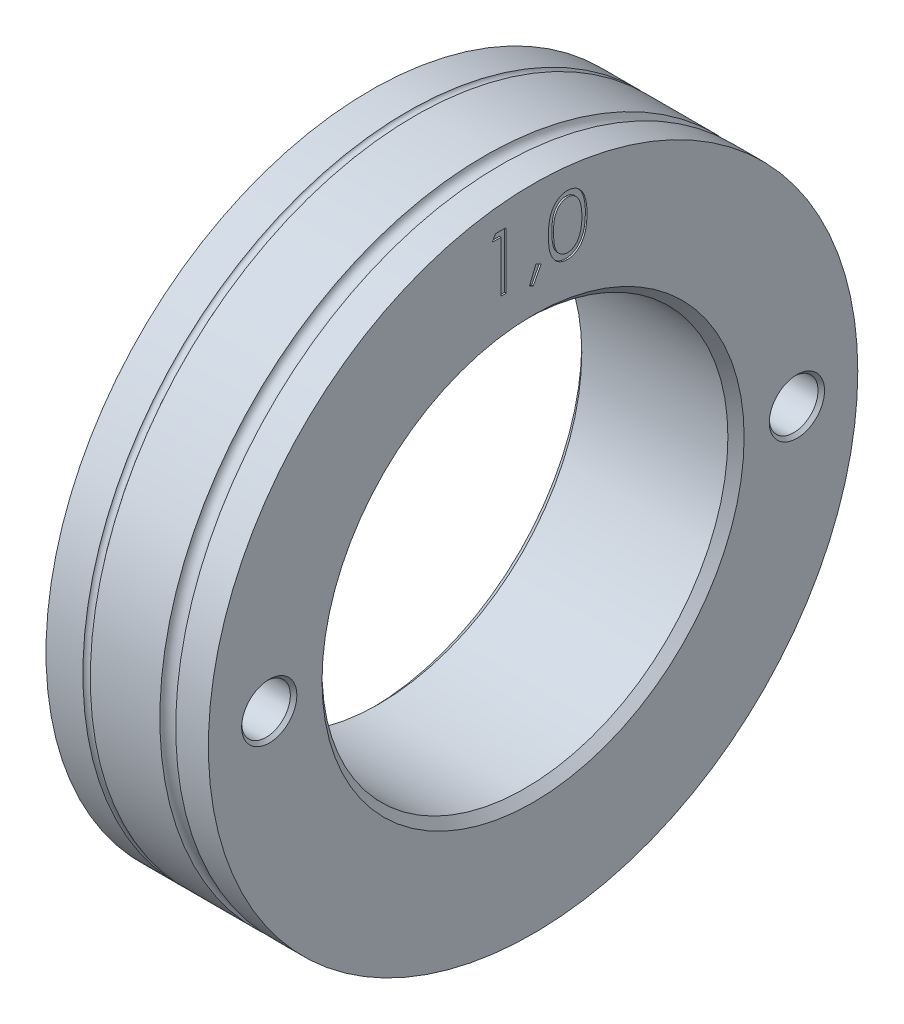
from build123d import *

# Parameters (mm, degrees)
CUT_EXTRUDE_1_DEPTH = 0.1
CUT_EXTRUDE_2_DEPTH = 0.1
SKETCH_5_R          = 1.5
CUT_EXTRUDE_3_DEPTH = 31.000000167
CHAMFER_1_SIZE      = 0.5
CHAMFER_2_SIZE      = 0.2


with BuildPart() as part:
    # Эскиз1 → Повернуть1 (revolve)
    with BuildSketch(Plane.XY):
        with BuildLine():
            Line((0, 12.5), (-10, 12.5))
            Line((-10, 12.5), (-10, 20))
            Line((-10, 20), (-7.727283258, 20))
            ThreePointArc((-7.727283258, 20), (-7.5, 19.854126465), (-7.272716742, 20))
            Line((-7.272716742, 20), (-2.989037503, 20))
            ThreePointArc((-2.989037503, 20), (-2.5, 19.604126465), (-2.010962497, 20))
            Line((-2.010962497, 20), (0, 20))
            Line((0, 20), (0, 12.5))
        make_face()
    revolve(axis=Axis((0, 0, 0), (-1, 0, 0)))

    # Эскиз2 → Вырез-Вытянуть1 (cut)
    # profile 1 of 3: a face of its own
    with BuildSketch(Plane.ZY.offset(10)):
        with BuildLine():
            add(Edge.make_bspline(
                [(-3.365384615, 16.748597756), (-3.365056597, 16.804695144), (-3.364419417, 16.913665128), (-3.357330996, 17.07244977), (-3.345555654, 17.221410059), (-3.329418281, 17.360553125), (-3.309780301, 17.48991489), (-3.283564814, 17.609149647), (-3.253752012, 17.718809254), (-3.219199566, 17.819251302), (-3.180211777, 17.911829005), (-3.137777516, 17.998254207), (-3.090212722, 18.078396139), (-3.040235809, 18.153533929), (-2.985823737, 18.222437624), (-2.928524947, 18.286080287), (-2.86610307, 18.342991037), (-2.800680062, 18.394837339), (-2.731663598, 18.440286811), (-2.661020932, 18.48031955), (-2.588265826, 18.514519417), (-2.513199643, 18.541409853), (-2.436497085, 18.5636207), (-2.357890018, 18.578809647), (-2.277248654, 18.588366556), (-2.22281722, 18.589280224), (-2.19521234, 18.58974359)],
                knots=[0, 0, 0, 0, 1.646270934, 3.197905019, 4.663502075, 6.030701355, 7.308322542, 8.50163776, 9.611534131, 10.641858119, 11.616356847, 12.558055219, 13.465016945, 14.349605745, 15.204443733, 16.039544428, 16.859896111, 17.680448484, 18.487036065, 19.28249412, 20.06191084, 20.843045899, 21.620316918, 22.403196591, 23.190181807, 24, 24, 24, 24], degree=3))
            add(Edge.make_bspline(
                [(-2.19521234, 18.58974359), (-2.167376861, 18.589255775), (-2.112020852, 18.588285664), (-2.030180477, 18.578961721), (-1.950230795, 18.563490598), (-1.872512657, 18.541569623), (-1.79638767, 18.514373947), (-1.722451263, 18.48028683), (-1.650244181, 18.440607962), (-1.580913893, 18.393984085), (-1.513699278, 18.342001809), (-1.450251315, 18.28323914), (-1.390564229, 18.218289421), (-1.333888924, 18.147847557), (-1.281833327, 18.070562472), (-1.232259894, 17.987778362), (-1.187887858, 17.898047497), (-1.145153183, 17.80286703), (-1.108266197, 17.699603371), (-1.074999951, 17.58883861), (-1.048120983, 17.469264423), (-1.02573171, 17.341508178), (-1.008386814, 17.205100695), (-0.995754172, 17.060334379), (-0.989081087, 16.907113989), (-0.987824386, 16.80235614), (-0.987179487, 16.748597756)],
                knots=[0, 0, 0, 0, 0.810914788, 1.612654377, 2.396697861, 3.181598691, 3.963628158, 4.749916497, 5.551656086, 6.361998678, 7.18212741, 8.025565596, 8.878627764, 9.750805457, 10.657531673, 11.591944965, 12.560506719, 13.57287815, 14.630710178, 15.753379473, 16.941251878, 18.199788006, 19.531962791, 20.947069417, 22.433333509, 24, 24, 24, 24], degree=3))
            add(Edge.make_bspline(
                [(-0.987179487, 16.748597756), (-0.987831072, 16.695073848), (-0.989100658, 16.590784697), (-0.995679364, 16.438253721), (-1.008637996, 16.294255678), (-1.024847984, 16.158445216), (-1.047298947, 16.031387597), (-1.074904113, 15.912643148), (-1.105554436, 15.801699077), (-1.14338923, 15.699464265), (-1.18479994, 15.604512542), (-1.229855137, 15.515845394), (-1.278124963, 15.432679101), (-1.330713708, 15.355679354), (-1.386767121, 15.284300697), (-1.44748491, 15.219803074), (-1.511155495, 15.160632402), (-1.578567911, 15.107980775), (-1.648979462, 15.06189597), (-1.720938539, 15.02068212), (-1.795721922, 14.987449425), (-1.871634875, 14.958914384), (-1.949763241, 14.937113932), (-2.030009632, 14.922040077), (-2.111965868, 14.911468228), (-2.167367433, 14.910661748), (-2.19521234, 14.91025641)],
                knots=[0, 0, 0, 0, 1.561518951, 3.042555995, 4.452378317, 5.7783523, 7.031515105, 8.214008947, 9.334062868, 10.386615937, 11.391082383, 12.354592575, 13.286541444, 14.194233754, 15.072674879, 15.931287219, 16.775624067, 17.606195743, 18.42308326, 19.229000347, 20.022332153, 20.807536673, 21.593273796, 22.3848459, 23.188221202, 24, 24, 24, 24], degree=3))
            add(Edge.make_bspline(
                [(-2.19521234, 14.91025641), (-2.222816454, 14.910722766), (-2.277246378, 14.911642328), (-2.357898804, 14.921156059), (-2.436181247, 14.936451562), (-2.512480001, 14.957868166), (-2.587186516, 14.984083003), (-2.659282803, 15.018236686), (-2.729570487, 15.057570755), (-2.797862043, 15.102366177), (-2.862874204, 15.15368786), (-2.924972809, 15.210452149), (-2.982597828, 15.27407556), (-3.036231924, 15.343553483), (-3.087206012, 15.418246725), (-3.134095385, 15.499175098), (-3.17746624, 15.586017709), (-3.21710973, 15.67933562), (-3.252258394, 15.780490547), (-3.283306102, 15.890639726), (-3.307820259, 16.010755362), (-3.328803215, 16.139872729), (-3.345727598, 16.278546659), (-3.357281923, 16.426852438), (-3.364423238, 16.584697647), (-3.365058308, 16.692967421), (-3.365384615, 16.748597756)],
                knots=[0, 0, 0, 0, 0.810891512, 1.598919785, 2.382837074, 3.152667961, 3.926044502, 4.706494248, 5.493654104, 6.291793342, 7.103789334, 7.925228297, 8.761435821, 9.622817696, 10.50288917, 11.416980706, 12.369136599, 13.353924996, 14.394355917, 15.514179734, 16.714354668, 17.994756427, 19.357759367, 20.818452758, 22.365282078, 24, 24, 24, 24], degree=3))
        make_face()
        with BuildLine():
            add(Edge.make_bspline(
                [(-3.051282051, 16.75), (-3.051162604, 16.703251301), (-3.050930781, 16.612521256), (-3.04487458, 16.480677995), (-3.036624348, 16.357707667), (-3.025983051, 16.24345413), (-3.010180103, 16.138304118), (-2.992473315, 16.041534435), (-2.970925225, 15.953657197), (-2.945430207, 15.874069387), (-2.91639111, 15.801420318), (-2.884685247, 15.733819103), (-2.850624524, 15.670467167), (-2.812505373, 15.611933558), (-2.77099031, 15.558027394), (-2.727017051, 15.507794562), (-2.678944467, 15.462997581), (-2.612440724, 15.409270726), (-2.52464425, 15.353751592), (-2.414023794, 15.305405502), (-2.300355344, 15.275023046), (-2.223204093, 15.27115929), (-2.184695513, 15.269230769)],
                knots=[0, 0, 0, 0, 1.459021318, 2.831673884, 4.118529203, 5.306027144, 6.411944654, 7.436330062, 8.375795394, 9.233974572, 10.042671642, 10.816086306, 11.563610507, 12.285937304, 12.993564865, 13.685989202, 14.367179055, 15.041617293, 16.353048772, 17.594441528, 18.799311195, 20, 20, 20, 20], degree=3))
            add(Edge.make_bspline(
                [(-2.184695513, 15.269230769), (-2.145937841, 15.27082855), (-2.068502518, 15.274020813), (-1.955368723, 15.30481955), (-1.845538453, 15.35128909), (-1.759466512, 15.406236595), (-1.693983969, 15.458564925), (-1.647066979, 15.503179573), (-1.60400493, 15.55313544), (-1.563162856, 15.607034736), (-1.52570378, 15.66590722), (-1.491640642, 15.729469796), (-1.460557295, 15.797898973), (-1.442848249, 15.845668713), (-1.433794071, 15.870092147)],
                knots=[0, 0, 0, 0, 1.353760809, 2.704726607, 4.075137775, 5.516104923, 6.260822281, 7.007110065, 7.778089737, 8.566572457, 9.372053459, 10.217411131, 11.088608312, 12, 12, 12, 12], degree=3))
            add(Edge.make_bspline(
                [(-1.433794071, 15.870092147), (-1.423242303, 15.901321887), (-1.401817689, 15.964731651), (-1.374205915, 16.063095303), (-1.352460515, 16.166298067), (-1.33289715, 16.273723184), (-1.319544094, 16.386162885), (-1.30879628, 16.503269269), (-1.302465594, 16.625130631), (-1.301680842, 16.707925622), (-1.301282051, 16.75)],
                knots=[0, 0, 0, 0, 0.884706709, 1.796334032, 2.740027952, 3.714592787, 4.726048262, 5.777819803, 6.87074269, 8, 8, 8, 8], degree=3))
            add(Edge.make_bspline(
                [(-1.301282051, 16.75), (-1.301832241, 16.792067573), (-1.302908528, 16.874360737), (-1.307022516, 16.994878918), (-1.31764609, 17.109346679), (-1.329445209, 17.218257152), (-1.34684243, 17.321007454), (-1.365600237, 17.418457759), (-1.39080145, 17.509400784), (-1.417721225, 17.595260366), (-1.44853162, 17.675061021), (-1.482447354, 17.749174807), (-1.518669113, 17.817959532), (-1.558011354, 17.881226473), (-1.600007037, 17.939259016), (-1.645764586, 17.990893611), (-1.693468959, 18.037730579), (-1.760286144, 18.091193148), (-1.847760434, 18.145704843), (-1.956606082, 18.195870603), (-2.069876726, 18.224678896), (-2.14645018, 18.228740583), (-2.184695513, 18.230769231)],
                knots=[0, 0, 0, 0, 1.31362396, 2.569729283, 3.763502607, 4.902122613, 5.988968491, 7.01645872, 7.998833611, 8.933434873, 9.825090667, 10.667526885, 11.477055099, 12.250526234, 12.991942729, 13.710640831, 14.402115721, 15.076753259, 16.378508321, 17.609869233, 18.806226677, 20, 20, 20, 20], degree=3))
            add(Edge.make_bspline(
                [(-2.184695513, 18.230769231), (-2.223406105, 18.228737784), (-2.300897811, 18.22467119), (-2.415345765, 18.195977936), (-2.525050117, 18.14596497), (-2.612293092, 18.091012598), (-2.679156878, 18.038674287), (-2.726239571, 17.993287833), (-2.770385744, 17.943641578), (-2.811053444, 17.889239663), (-2.849142727, 17.830774296), (-2.88412374, 17.767785531), (-2.915641069, 17.699954167), (-2.944725605, 17.627337732), (-2.970298393, 17.547756787), (-2.991392357, 17.459987794), (-3.01087941, 17.363525902), (-3.024674679, 17.257806394), (-3.036938434, 17.14352424), (-3.044819782, 17.020246922), (-3.05095104, 16.888182542), (-3.051169504, 16.796983383), (-3.051282051, 16.75)],
                knots=[0, 0, 0, 0, 1.207732386, 2.417664972, 3.655092373, 4.956220595, 5.625982001, 6.301752483, 6.994047911, 7.697131622, 8.419323945, 9.170223765, 9.943494443, 10.752040957, 11.610060368, 12.549350801, 13.567764191, 14.679664412, 15.874934091, 17.154273443, 18.533957287, 20, 20, 20, 20], degree=3))
        make_face(mode=Mode.SUBTRACT)
    # profile 2 of 3: a face of its own
    with BuildSketch(Plane.ZY.offset(10)):
        with BuildLine():
            add(Edge.make_bspline(
                [(-0.112179487, 15.538461538), (-0.092689275, 15.537303372), (-0.054480993, 15.535032921), (0.000758136, 15.519456248), (0.050752795, 15.491797587), (0.09528504, 15.454934809), (0.131991517, 15.410239146), (0.160635869, 15.360643237), (0.176076854, 15.304941644), (0.178330766, 15.266511969), (0.179487179, 15.246794872)],
                knots=[0, 0, 0, 0, 1.020151414, 1.999887582, 2.974338812, 3.990962822, 5.007586832, 5.987933904, 6.967670073, 8, 8, 8, 8], degree=3))
            add(Edge.make_bspline(
                [(0.179487179, 15.246794872), (0.178291579, 15.227551542), (0.175933872, 15.189603978), (0.160671264, 15.134322516), (0.131773213, 15.084695611), (0.09553822, 15.039393473), (0.050741787, 15.002452603), (0.00063994, 14.975029258), (-0.054351318, 14.958337278), (-0.092667641, 14.956210981), (-0.112179487, 14.955128205)],
                knots=[0, 0, 0, 0, 1.009421747, 1.99056486, 2.972319754, 3.999869655, 5.017953583, 5.993804169, 6.978383603, 8, 8, 8, 8], degree=3))
            add(Edge.make_bspline(
                [(-0.112179487, 14.955128205), (-0.131705393, 14.956171802), (-0.169825075, 14.958209177), (-0.22461107, 14.975371984), (-0.275018038, 15.002195444), (-0.31980575, 15.039462353), (-0.356344222, 15.084462497), (-0.383969604, 15.134664293), (-0.400559753, 15.189445731), (-0.402741626, 15.227520373), (-0.403846154, 15.246794872)],
                knots=[0, 0, 0, 0, 1.022052826, 1.995314843, 2.982371812, 4.00089066, 5.028879526, 6.005146991, 6.990147033, 8, 8, 8, 8], degree=3))
            add(Edge.make_bspline(
                [(-0.403846154, 15.246794872), (-0.402784055, 15.266544251), (-0.400710436, 15.305102491), (-0.383934776, 15.360301599), (-0.356558564, 15.410470038), (-0.319553169, 15.454866618), (-0.275028873, 15.492053921), (-0.224732668, 15.519118714), (-0.169693128, 15.535159126), (-0.131683189, 15.537341643), (-0.112179487, 15.538461538)],
                knots=[0, 0, 0, 0, 1.032775665, 2.016367738, 2.991239715, 4.008302682, 5.025365648, 6.011011707, 6.979408107, 8, 8, 8, 8], degree=3))
        make_face()
    # profile 3 of 3: a face of its own
    with BuildSketch(Plane.ZY.offset(10)):
        with BuildLine():
            Line((2.826923077, 18.5), (2.826923077, 18.141025641))
            Line((2.826923077, 18.141025641), (1.636418269, 18.141025641))
            Line((1.636418269, 18.141025641), (1.447816506, 17.220452724))
            add(Edge.make_bspline(
                [(1.447816506, 17.220452724), (1.484872381, 17.230682996), (1.556662277, 17.25050253), (1.662622138, 17.2725083), (1.763214341, 17.285773744), (1.828489711, 17.287585055), (1.860076122, 17.288461538)],
                knots=[0, 0, 0, 0, 1.100273476, 2.13160584, 3.095893838, 4, 4, 4, 4], degree=3))
            add(Edge.make_bspline(
                [(1.860076122, 17.288461538), (1.899159862, 17.287615603), (1.976008259, 17.285952282), (2.088447206, 17.269980432), (2.195780099, 17.244840518), (2.297782469, 17.209719996), (2.39464302, 17.164810263), (2.485470581, 17.108710322), (2.571628494, 17.043176991), (2.651571088, 16.967831979), (2.724095396, 16.884910363), (2.787861386, 16.795752492), (2.842023976, 16.701224829), (2.885584731, 16.600424221), (2.920369066, 16.494465067), (2.94352106, 16.382232485), (2.958937769, 16.264784365), (2.960660156, 16.184479795), (2.961538462, 16.143529647)],
                knots=[0, 0, 0, 0, 1.052922333, 2.070308379, 3.05430497, 4.020497103, 4.973039431, 5.925935799, 6.892292201, 7.88610001, 8.88166317, 9.857072816, 10.836096531, 11.812156883, 12.81219415, 13.836441305, 14.89672472, 16, 16, 16, 16], degree=3))
            add(Edge.make_bspline(
                [(2.961538462, 16.143529647), (2.960873386, 16.115007427), (2.959552224, 16.05834844), (2.952833636, 15.974204239), (2.93989792, 15.891841406), (2.922530196, 15.811249014), (2.899987778, 15.732579642), (2.872698724, 15.655608114), (2.839302696, 15.580813507), (2.802671321, 15.507488112), (2.761424843, 15.437289605), (2.715646336, 15.371640618), (2.667280845, 15.309556337), (2.615239459, 15.251702604), (2.559038464, 15.198459586), (2.499358497, 15.149511304), (2.436675778, 15.104029974), (2.370020536, 15.063861779), (2.300878053, 15.026898823), (2.228249836, 14.996575285), (2.153789135, 14.969464757), (2.07642426, 14.94785523), (1.996330447, 14.930922675), (1.913375672, 14.919422075), (1.827995002, 14.911045637), (1.770119989, 14.91052128), (1.740885417, 14.91025641)],
                knots=[0, 0, 0, 0, 1.056347294, 2.098418968, 3.122841568, 4.141288669, 5.149314143, 6.15115421, 7.162517403, 8.180376062, 9.185164535, 10.17417709, 11.141909838, 12.097768115, 13.052685741, 14.0056014, 14.954263652, 15.917497458, 16.885230207, 17.854509472, 18.828990115, 19.81800267, 20.826176721, 21.857883937, 22.917946725, 24, 24, 24, 24], degree=3))
            add(Edge.make_bspline(
                [(1.740885417, 14.91025641), (1.706011236, 14.910947248), (1.637400405, 14.91230639), (1.536879838, 14.926524876), (1.440165232, 14.946888792), (1.348035131, 14.977525062), (1.259663868, 15.015912357), (1.17624115, 15.064428528), (1.095635374, 15.119407632), (1.021123337, 15.184287985), (0.951967224, 15.255203667), (0.890060715, 15.332161308), (0.834927138, 15.41389075), (0.787449391, 15.500788904), (0.74695137, 15.592627435), (0.715136381, 15.689750436), (0.689458026, 15.79165044), (0.678594606, 15.86180395), (0.673076923, 15.897435897)],
                knots=[0, 0, 0, 0, 1.0467383, 2.05933395, 3.04377827, 4.011590433, 4.970194871, 5.932262533, 6.905835911, 7.896367577, 8.894135286, 9.877477877, 10.858688626, 11.851381753, 12.8477658, 13.868841284, 14.917554742, 16, 16, 16, 16], degree=3))
            Line((0.673076923, 15.897435897), (0.987179487, 15.897435897))
            add(Edge.make_bspline(
                [(0.987179487, 15.897435897), (0.994908045, 15.864059445), (1.009762761, 15.79990805), (1.04236851, 15.709776709), (1.082234385, 15.629457485), (1.129638734, 15.557887902), (1.186188764, 15.495478905), (1.250718193, 15.439861843), (1.323065916, 15.389686713), (1.403459146, 15.347863946), (1.488272225, 15.312195193), (1.577039435, 15.288443498), (1.667343782, 15.271742605), (1.728422152, 15.270070844), (1.759114583, 15.269230769)],
                knots=[0, 0, 0, 0, 1.136247022, 2.183929868, 3.172523383, 4.106158343, 5.02341133, 5.958108904, 6.928429099, 7.938127109, 8.96079061, 9.975095812, 10.982467395, 12, 12, 12, 12], degree=3))
            add(Edge.make_bspline(
                [(1.759114583, 15.269230769), (1.789073028, 15.270051547), (1.84806145, 15.271667666), (1.934872837, 15.284106678), (2.018685711, 15.303264249), (2.098673068, 15.331934104), (2.176234607, 15.366778822), (2.249408378, 15.411493898), (2.320311255, 15.462953917), (2.386739388, 15.521910547), (2.447578838, 15.586880241), (2.501334959, 15.656357635), (2.546111872, 15.730474481), (2.583845981, 15.807947634), (2.61249928, 15.889626191), (2.632940261, 15.975127366), (2.64494332, 16.064662347), (2.6465945, 16.125731656), (2.647435897, 16.156850962)],
                knots=[0, 0, 0, 0, 1.027316725, 2.022795036, 3.002884548, 3.971462791, 4.93288096, 5.914575861, 6.907176829, 7.935150275, 8.956128384, 9.956726525, 10.942570165, 11.921478529, 12.907843606, 13.90538589, 14.932640048, 16, 16, 16, 16], degree=3))
            add(Edge.make_bspline(
                [(2.647435897, 16.156850962), (2.646777418, 16.184926713), (2.645488538, 16.239881002), (2.634957968, 16.320280209), (2.616640995, 16.396353251), (2.591217116, 16.468467485), (2.558937608, 16.536690927), (2.519491295, 16.601093987), (2.472137898, 16.660827821), (2.418046009, 16.715920374), (2.358787968, 16.766765249), (2.293344225, 16.810109336), (2.223084299, 16.846573253), (2.148854699, 16.878041252), (2.068889801, 16.900641997), (1.984773168, 16.917609882), (1.89559646, 16.927425245), (1.834625772, 16.928787134), (1.803285256, 16.929487179)],
                knots=[0, 0, 0, 0, 1.045622112, 2.046656509, 3.013763289, 3.955457236, 4.890082067, 5.820317437, 6.762574623, 7.722996705, 8.69280354, 9.665887285, 10.63943826, 11.638615906, 12.663482002, 13.728887084, 14.832589034, 16, 16, 16, 16], degree=3))
            add(Edge.make_bspline(
                [(1.803285256, 16.929487179), (1.776156328, 16.928906588), (1.720141972, 16.927707815), (1.634219146, 16.918881318), (1.543927423, 16.904642024), (1.449612927, 16.885055776), (1.350992419, 16.859424699), (1.248274018, 16.828710199), (1.141241752, 16.7919882), (1.069124027, 16.764255986), (1.032051282, 16.75)],
                knots=[0, 0, 0, 0, 0.817624296, 1.688186739, 2.600797293, 3.572016777, 4.590301741, 5.671205678, 6.80286297, 8, 8, 8, 8], degree=3))
            Line((1.032051282, 16.75), (1.391025641, 18.5))
            Line((1.391025641, 18.5), (2.826923077, 18.5))
        make_face()
    extrude(amount=-CUT_EXTRUDE_1_DEPTH, mode=Mode.SUBTRACT)

    # Эскиз4 → Вырез-Вытянуть2 (cut)
    # profile 1 of 3: a face of its own
    with BuildSketch(Plane(origin=(0, 0, 0), x_dir=(0, 0, -1), z_dir=(1, 0, 0))):
        with BuildLine():
            add(Edge.make_bspline(
                [(0.942307692, 16.748597756), (0.94263571, 16.804695144), (0.94327289, 16.913665128), (0.950361311, 17.07244977), (0.962136654, 17.221410059), (0.978274027, 17.360553125), (0.997912007, 17.48991489), (1.024127493, 17.609149647), (1.053940296, 17.718809254), (1.088492742, 17.819251302), (1.127480531, 17.911829005), (1.169914792, 17.998254207), (1.217479586, 18.078396139), (1.267456499, 18.153533929), (1.321868571, 18.222437624), (1.379167361, 18.286080287), (1.441589237, 18.342991037), (1.507012246, 18.394837339), (1.57602871, 18.440286811), (1.646671376, 18.48031955), (1.719426482, 18.514519417), (1.794492665, 18.541409853), (1.871195223, 18.5636207), (1.949802289, 18.578809647), (2.030443653, 18.588366556), (2.084875088, 18.589280224), (2.112479968, 18.58974359)],
                knots=[0, 0, 0, 0, 1.646270934, 3.197905019, 4.663502075, 6.030701355, 7.308322542, 8.50163776, 9.611534131, 10.641858119, 11.616356847, 12.558055219, 13.465016945, 14.349605745, 15.204443733, 16.039544428, 16.859896111, 17.680448484, 18.487036065, 19.28249412, 20.06191084, 20.843045899, 21.620316918, 22.403196591, 23.190181807, 24, 24, 24, 24], degree=3))
            add(Edge.make_bspline(
                [(2.112479968, 18.58974359), (2.140315446, 18.589255775), (2.195671455, 18.588285664), (2.277511831, 18.578961721), (2.357461512, 18.563490598), (2.435179651, 18.541569623), (2.511304637, 18.514373947), (2.585241045, 18.48028683), (2.657448127, 18.440607962), (2.726778414, 18.393984085), (2.79399303, 18.342001809), (2.857440993, 18.28323914), (2.917128078, 18.218289421), (2.973803384, 18.147847557), (3.025858981, 18.070562472), (3.075432413, 17.987778362), (3.119804449, 17.898047497), (3.162539124, 17.80286703), (3.199426111, 17.699603371), (3.232692356, 17.58883861), (3.259571325, 17.469264423), (3.281960597, 17.341508178), (3.299305493, 17.205100695), (3.311938135, 17.060334379), (3.31861122, 16.907113989), (3.319867922, 16.80235614), (3.320512821, 16.748597756)],
                knots=[0, 0, 0, 0, 0.810914788, 1.612654377, 2.396697861, 3.181598691, 3.963628158, 4.749916497, 5.551656086, 6.361998678, 7.18212741, 8.025565596, 8.878627764, 9.750805457, 10.657531673, 11.591944965, 12.560506719, 13.57287815, 14.630710178, 15.753379473, 16.941251878, 18.199788006, 19.531962791, 20.947069417, 22.433333509, 24, 24, 24, 24], degree=3))
            add(Edge.make_bspline(
                [(3.320512821, 16.748597756), (3.319861236, 16.695073848), (3.31859165, 16.590784697), (3.312012943, 16.438253721), (3.299054312, 16.294255678), (3.282844324, 16.158445216), (3.260393361, 16.031387597), (3.232788195, 15.912643148), (3.202137872, 15.801699077), (3.164303078, 15.699464265), (3.122892367, 15.604512542), (3.077837171, 15.515845394), (3.029567345, 15.432679101), (2.9769786, 15.355679354), (2.920925187, 15.284300697), (2.860207398, 15.219803074), (2.796536813, 15.160632402), (2.729124397, 15.107980775), (2.658712846, 15.06189597), (2.586753769, 15.02068212), (2.511970386, 14.987449425), (2.436057433, 14.958914384), (2.357929067, 14.937113932), (2.277682676, 14.922040077), (2.19572644, 14.911468228), (2.140324875, 14.910661748), (2.112479968, 14.91025641)],
                knots=[0, 0, 0, 0, 1.561518951, 3.042555995, 4.452378317, 5.7783523, 7.031515105, 8.214008947, 9.334062868, 10.386615937, 11.391082383, 12.354592575, 13.286541444, 14.194233754, 15.072674879, 15.931287219, 16.775624067, 17.606195743, 18.42308326, 19.229000347, 20.022332153, 20.807536673, 21.593273796, 22.3848459, 23.188221202, 24, 24, 24, 24], degree=3))
            add(Edge.make_bspline(
                [(2.112479968, 14.91025641), (2.084875854, 14.910722766), (2.030445929, 14.911642328), (1.949793504, 14.921156059), (1.87151106, 14.936451562), (1.795212306, 14.957868166), (1.720505791, 14.984083003), (1.648409505, 15.018236686), (1.578121821, 15.057570755), (1.509830265, 15.102366177), (1.444818104, 15.15368786), (1.382719498, 15.210452149), (1.325094479, 15.27407556), (1.271460384, 15.343553483), (1.220486296, 15.418246725), (1.173596922, 15.499175098), (1.130226068, 15.586017709), (1.090582578, 15.67933562), (1.055433914, 15.780490547), (1.024386206, 15.890639726), (0.999872048, 16.010755362), (0.978889093, 16.139872729), (0.96196471, 16.278546659), (0.950410385, 16.426852438), (0.94326907, 16.584697647), (0.942633999, 16.692967421), (0.942307692, 16.748597756)],
                knots=[0, 0, 0, 0, 0.810891512, 1.598919785, 2.382837074, 3.152667961, 3.926044502, 4.706494248, 5.493654104, 6.291793342, 7.103789334, 7.925228297, 8.761435821, 9.622817696, 10.50288917, 11.416980706, 12.369136599, 13.353924996, 14.394355917, 15.514179734, 16.714354668, 17.994756427, 19.357759367, 20.818452758, 22.365282078, 24, 24, 24, 24], degree=3))
        make_face()
        with BuildLine():
            add(Edge.make_bspline(
                [(1.256410256, 16.75), (1.256529703, 16.703251301), (1.256761527, 16.612521256), (1.262817727, 16.480677995), (1.271067959, 16.357707667), (1.281709257, 16.24345413), (1.297512205, 16.138304118), (1.315218993, 16.041534435), (1.336767083, 15.953657197), (1.3622621, 15.874069387), (1.391301197, 15.801420318), (1.423007061, 15.733819103), (1.457067784, 15.670467167), (1.495186934, 15.611933558), (1.536701998, 15.558027394), (1.580675257, 15.507794562), (1.628747841, 15.462997581), (1.695251584, 15.409270726), (1.783048058, 15.353751592), (1.893668513, 15.305405502), (2.007336964, 15.275023046), (2.084488214, 15.27115929), (2.122996795, 15.269230769)],
                knots=[0, 0, 0, 0, 1.459021318, 2.831673884, 4.118529203, 5.306027144, 6.411944654, 7.436330062, 8.375795394, 9.233974572, 10.042671642, 10.816086306, 11.563610507, 12.285937304, 12.993564865, 13.685989202, 14.367179055, 15.041617293, 16.353048772, 17.594441528, 18.799311195, 20, 20, 20, 20], degree=3))
            add(Edge.make_bspline(
                [(2.122996795, 15.269230769), (2.161754467, 15.27082855), (2.23918979, 15.274020813), (2.352323585, 15.30481955), (2.462153855, 15.35128909), (2.548225795, 15.406236595), (2.613708339, 15.458564925), (2.660625329, 15.503179573), (2.703687377, 15.55313544), (2.744529452, 15.607034736), (2.781988528, 15.66590722), (2.816051665, 15.729469796), (2.847135013, 15.797898973), (2.864844059, 15.845668713), (2.873898237, 15.870092147)],
                knots=[0, 0, 0, 0, 1.353760809, 2.704726607, 4.075137775, 5.516104923, 6.260822281, 7.007110065, 7.778089737, 8.566572457, 9.372053459, 10.217411131, 11.088608312, 12, 12, 12, 12], degree=3))
            add(Edge.make_bspline(
                [(2.873898237, 15.870092147), (2.884450005, 15.901321887), (2.905874619, 15.964731651), (2.933486393, 16.063095303), (2.955231792, 16.166298067), (2.974795158, 16.273723184), (2.988148214, 16.386162885), (2.998896027, 16.503269269), (3.005226714, 16.625130631), (3.006011465, 16.707925622), (3.006410256, 16.75)],
                knots=[0, 0, 0, 0, 0.884706709, 1.796334032, 2.740027952, 3.714592787, 4.726048262, 5.777819803, 6.87074269, 8, 8, 8, 8], degree=3))
            add(Edge.make_bspline(
                [(3.006410256, 16.75), (3.005860067, 16.792067573), (3.004783779, 16.874360737), (3.000669792, 16.994878918), (2.990046217, 17.109346679), (2.978247098, 17.218257152), (2.960849877, 17.321007454), (2.94209207, 17.418457759), (2.916890858, 17.509400784), (2.889971083, 17.595260366), (2.859160688, 17.675061021), (2.825244953, 17.749174807), (2.789023195, 17.817959532), (2.749680954, 17.881226473), (2.707685271, 17.939259016), (2.661927722, 17.990893611), (2.614223349, 18.037730579), (2.547406163, 18.091193148), (2.459931873, 18.145704843), (2.351086226, 18.195870603), (2.237815582, 18.224678896), (2.161242128, 18.228740583), (2.122996795, 18.230769231)],
                knots=[0, 0, 0, 0, 1.31362396, 2.569729283, 3.763502607, 4.902122613, 5.988968491, 7.01645872, 7.998833611, 8.933434873, 9.825090667, 10.667526885, 11.477055099, 12.250526234, 12.991942729, 13.710640831, 14.402115721, 15.076753259, 16.378508321, 17.609869233, 18.806226677, 20, 20, 20, 20], degree=3))
            add(Edge.make_bspline(
                [(2.122996795, 18.230769231), (2.084286203, 18.228737784), (2.006794497, 18.22467119), (1.892346542, 18.195977936), (1.782642191, 18.14596497), (1.695399216, 18.091012598), (1.62853543, 18.038674287), (1.581452736, 17.993287833), (1.537306564, 17.943641578), (1.496638864, 17.889239663), (1.458549581, 17.830774296), (1.423568568, 17.767785531), (1.392051238, 17.699954167), (1.362966702, 17.627337732), (1.337393914, 17.547756787), (1.316299951, 17.459987794), (1.296812898, 17.363525902), (1.283017629, 17.257806394), (1.270753873, 17.14352424), (1.262872525, 17.020246922), (1.256741268, 16.888182542), (1.256522803, 16.796983383), (1.256410256, 16.75)],
                knots=[0, 0, 0, 0, 1.207732386, 2.417664972, 3.655092373, 4.956220595, 5.625982001, 6.301752483, 6.994047911, 7.697131622, 8.419323945, 9.170223765, 9.943494443, 10.752040957, 11.610060368, 12.549350801, 13.567764191, 14.679664412, 15.874934091, 17.154273443, 18.533957287, 20, 20, 20, 20], degree=3))
        make_face(mode=Mode.SUBTRACT)
    # profile 2 of 3: a face of its own
    with BuildSketch(Plane(origin=(0, 0, 0), x_dir=(0, 0, -1), z_dir=(1, 0, 0))):
        Polygon((0.172475962, 15.628205128), (0.493589744, 15.47255609), (0.011217949, 14.551282051), (-0.224358974, 14.653645833), align=None)
    # profile 3 of 3: a face of its own
    with BuildSketch(Plane(origin=(0, 0, 0), x_dir=(0, 0, -1), z_dir=(1, 0, 0))):
        Polygon((-2.307391827, 18.5), (-1.66025641, 18.5), (-1.66025641, 15), (-1.974358974, 15), (-1.974358974, 18.141025641), (-2.512820513, 18.141025641), align=None)
    extrude(amount=-CUT_EXTRUDE_2_DEPTH, mode=Mode.SUBTRACT)

    # Эскиз5 → Вырез-Вытянуть3 (cut, through all)
    with BuildSketch(Plane.ZY.offset(10)):
        with Locations((-16.25, 0)):
            Circle(SKETCH_5_R)
        with Locations((16.25, 0)):
            Circle(SKETCH_5_R)
    extrude(amount=-CUT_EXTRUDE_3_DEPTH, mode=Mode.SUBTRACT)

    # Фаска1
    chamfer_1_edges = [part.edges().sort_by_distance(p)[0] for p in [
        (0, -12.5, 0),
        (-10, -12.5, 0),
    ]]
    chamfer(chamfer_1_edges, length=CHAMFER_1_SIZE)

    # Фаска2
    chamfer_2_edges = [part.edges().sort_by_distance(p)[0] for p in [
        (0, 0, -17.75),
        (0, 0, 14.75),
        (-10, 0, 14.75),
        (-10, 0, -17.75),
    ]]
    chamfer(chamfer_2_edges, length=CHAMFER_2_SIZE)


solid = part.part
